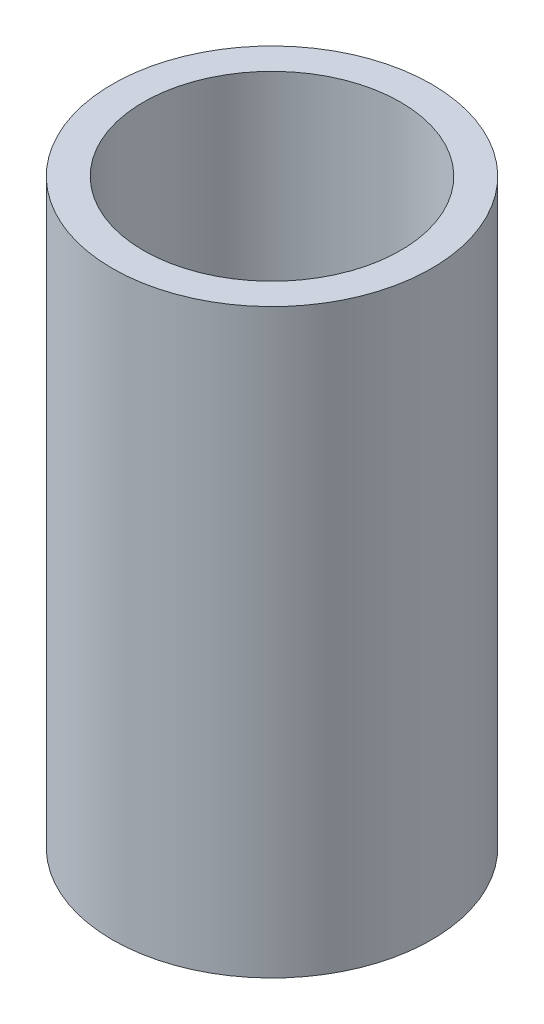
from build123d import *

# Parameters (mm, degrees)
SKETCH1_R           = 22.5
BOSS_EXTRUDE1_DEPTH = 81.970041134
SKETCH2_R           = 18.123923447
CUT_EXTRUDE1_DEPTH  = 88.929446965


with BuildPart() as part:
    # Sketch1 → Boss-Extrude1 (new body)
    with BuildSketch(Plane(origin=(0, 0, 0), x_dir=(1, 0, 0), z_dir=(0, 1, 0))):
        Circle(SKETCH1_R)
    extrude(amount=BOSS_EXTRUDE1_DEPTH)

    # Sketch2 → Cut-Extrude1 (cut, through all)
    with BuildSketch(Plane(origin=(0, 0, 0), x_dir=(1, 0, 0), z_dir=(0, 1, 0))):
        Circle(SKETCH2_R)
    extrude(amount=CUT_EXTRUDE1_DEPTH, mode=Mode.SUBTRACT)


solid = part.part
